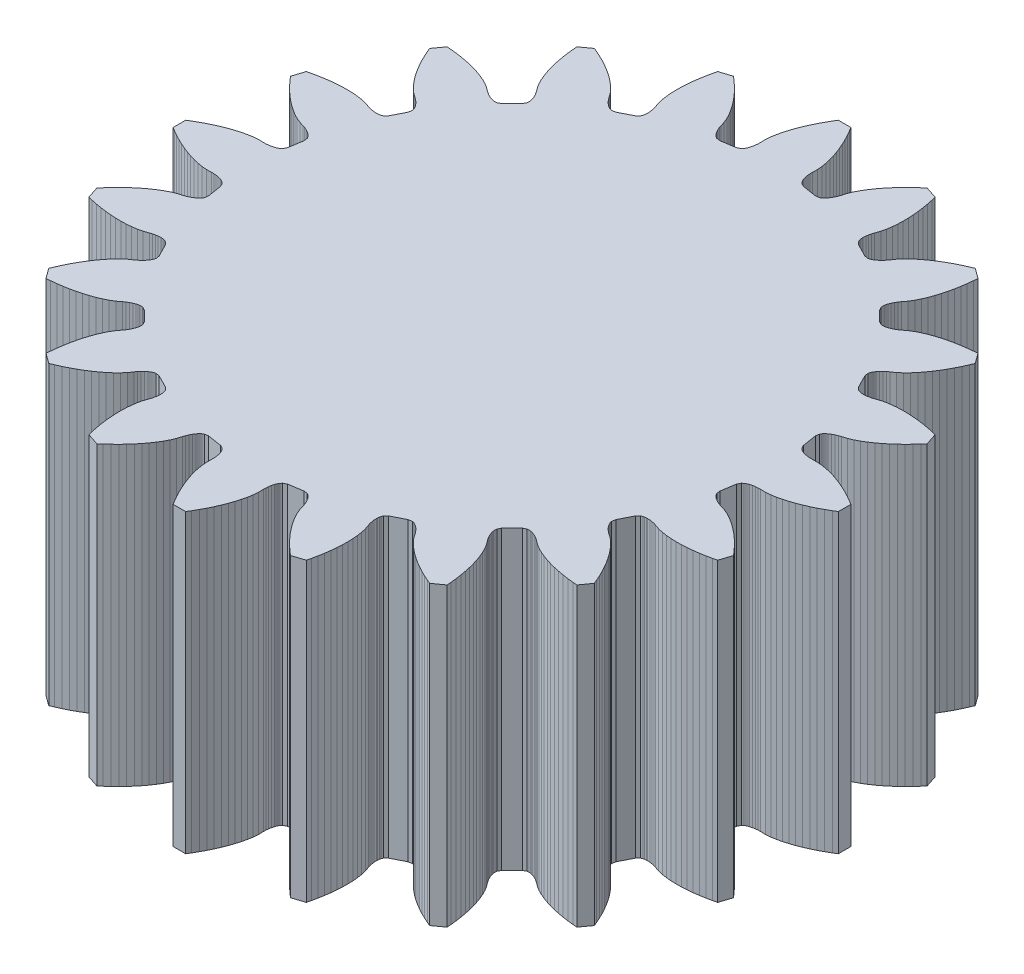
from build123d import *

# Parameters (mm, degrees)
BOSS_EXTRUDE1_DEPTH = 10


with BuildPart() as part:
    # Sketch1 → Boss-Extrude1 (new body)
    with BuildSketch(Plane(origin=(0, 0, 0), x_dir=(1, 0, 0), z_dir=(0, 1, 0))):
        Polygon((19.92687, 12.3554), (19.98148, 12.24614), (20.02708, 12.20669), (20.07113, 12.17955), (20.11437, 12.15911), (20.15707, 12.14317), (20.24143, 12.12063), (20.32482, 12.10703), (20.40752, 12.10005), (20.48971, 12.09838), (20.65336, 12.10249), (20.81867, 12.0882), (20.9851, 12.05997), (21.15222, 12.02082), (21.31978, 11.97211), (21.48756, 11.91469), (21.65538, 11.8491), (21.82305, 11.77576), (21.99042, 11.69495), (22.15733, 11.60692), (22.32361, 11.51187), (22.44783, 11.43607), (22.44783, 11.01375), (22.32361, 10.93794), (22.15733, 10.84289), (21.99042, 10.75486), (21.82305, 10.67406), (21.65538, 10.60071), (21.48756, 10.53512), (21.31978, 10.4777), (21.15222, 10.429), (20.9851, 10.38984), (20.81867, 10.36162), (20.65336, 10.34733), (20.48971, 10.35143), (20.40752, 10.34976), (20.32482, 10.34278), (20.24143, 10.32918), (20.15707, 10.30665), (20.11437, 10.2907), (20.07113, 10.27026), (20.02708, 10.24312), (19.98148, 10.20368), (19.92687, 10.09441), (19.85031, 9.61102), (19.86848, 9.49022), (19.89966, 9.43862), (19.93317, 9.39919), (19.96797, 9.36639), (20.00366, 9.33803), (20.07692, 9.29053), (20.15203, 9.25183), (20.22853, 9.21963), (20.30618, 9.19265), (20.46309, 9.14598), (20.61589, 9.08131), (20.76545, 9.00304), (20.91229, 8.91415), (21.0566, 8.81605), (21.19843, 8.7096), (21.33776, 8.59536), (21.47457, 8.47379), (21.60877, 8.34522), (21.74031, 8.20992), (21.86908, 8.06814), (21.96379, 7.95766), (21.83329, 7.55601), (21.69173, 7.5223), (21.50421, 7.48328), (21.31827, 7.45114), (21.13412, 7.42601), (20.95199, 7.40807), (20.77212, 7.39755), (20.5948, 7.39478), (20.42039, 7.40024), (20.24935, 7.41465), (20.08235, 7.43923), (19.92071, 7.47673), (19.76634, 7.5312), (19.68766, 7.55501), (19.60684, 7.57393), (19.52333, 7.58676), (19.43615, 7.5914), (19.3906, 7.58943), (19.34316, 7.58335), (19.29288, 7.57115), (19.23733, 7.54773), (19.15163, 7.46069), (18.92943, 7.02461), (18.90939, 6.90411), (18.92309, 6.8454), (18.94278, 6.79755), (18.96574, 6.7556), (18.99092, 6.7176), (19.04592, 6.64978), (19.10539, 6.58977), (19.1682, 6.53551), (19.2337, 6.48585), (19.36851, 6.39298), (19.49385, 6.28425), (19.61191, 6.16359), (19.7241, 6.03368), (19.83103, 5.89579), (19.93302, 5.75072), (20.03023, 5.59902), (20.12277, 5.44112), (20.21068, 5.27737), (20.29397, 5.10805), (20.37262, 4.93341), (20.42856, 4.79907), (20.18032, 4.45741), (20.03528, 4.46909), (19.84488, 4.48993), (19.65811, 4.51682), (19.47521, 4.54983), (19.29644, 4.58904), (19.12213, 4.63462), (18.95264, 4.68679), (18.78845, 4.74587), (18.63023, 4.81243), (18.479, 4.88742), (18.33686, 4.97302), (18.20688, 5.07254), (18.1394, 5.11949), (18.06839, 5.16246), (17.99293, 5.20047), (17.91144, 5.23182), (17.86752, 5.24403), (17.82053, 5.25291), (17.76893, 5.25684), (17.70886, 5.25173), (17.60046, 5.19543), (17.25438, 4.84936), (17.19809, 4.74095), (17.19297, 4.68088), (17.19691, 4.62929), (17.20579, 4.58229), (17.21799, 4.53837), (17.24934, 4.45688), (17.28735, 4.38142), (17.33032, 4.31041), (17.37728, 4.24294), (17.47679, 4.11296), (17.5624, 3.97082), (17.63739, 3.81959), (17.70394, 3.66136), (17.76303, 3.49718), (17.81519, 3.32769), (17.86077, 3.15337), (17.89999, 2.97461), (17.93299, 2.7917), (17.95988, 2.60493), (17.98072, 2.41454), (17.99241, 2.26949), (17.65074, 2.02126), (17.51641, 2.07719), (17.34177, 2.15585), (17.17245, 2.23914), (17.0087, 2.32704), (16.8508, 2.41958), (16.6991, 2.5168), (16.55402, 2.61878), (16.41613, 2.72572), (16.28622, 2.83791), (16.16556, 2.95596), (16.05684, 3.0813), (15.96397, 3.21611), (15.91431, 3.28162), (15.86005, 3.34443), (15.80003, 3.40389), (15.73222, 3.45889), (15.69421, 3.48407), (15.65226, 3.50704), (15.60441, 3.52672), (15.5457, 3.54043), (15.42521, 3.52038), (14.98913, 3.29819), (14.90209, 3.21249), (14.87866, 3.15693), (14.86646, 3.10665), (14.86038, 3.05921), (14.85842, 3.01367), (14.86305, 2.92648), (14.87588, 2.84297), (14.8948, 2.76215), (14.91861, 2.68347), (14.97309, 2.5291), (15.01058, 2.36747), (15.03517, 2.20046), (15.04957, 2.02942), (15.05503, 1.85501), (15.05227, 1.6777), (15.04175, 1.49783), (15.0238, 1.31569), (14.99867, 1.13154), (14.96653, 0.9456), (14.92751, 0.75809), (14.89381, 0.61653), (14.49216, 0.48602), (14.38168, 0.58073), (14.23989, 0.70951), (14.1046, 0.84104), (13.97603, 0.97525), (13.85445, 1.11205), (13.74022, 1.25139), (13.63376, 1.39321), (13.53566, 1.53752), (13.44678, 1.68436), (13.36851, 1.83392), (13.30383, 1.98673), (13.25717, 2.14364), (13.23018, 2.22128), (13.19799, 2.29779), (13.15928, 2.37289), (13.11178, 2.44615), (13.08342, 2.48184), (13.05062, 2.51665), (13.01119, 2.55016), (12.95959, 2.58133), (12.8388, 2.5995), (12.3554, 2.52294), (12.24614, 2.46833), (12.20669, 2.42274), (12.17955, 2.37868), (12.15911, 2.33545), (12.14317, 2.29274), (12.12063, 2.20838), (12.10703, 2.125), (12.10005, 2.04229), (12.09838, 1.9601), (12.10249, 1.79645), (12.0882, 1.63114), (12.05997, 1.46472), (12.02082, 1.29759), (11.97211, 1.13003), (11.91469, 0.96225), (11.8491, 0.79443), (11.77576, 0.62676), (11.69495, 0.45939), (11.60692, 0.29248), (11.51187, 0.1262), (11.43607, 0.00199), (11.01375, 0.00199), (10.93794, 0.1262), (10.84289, 0.29248), (10.75486, 0.45939), (10.67406, 0.62676), (10.60071, 0.79443), (10.53512, 0.96225), (10.4777, 1.13003), (10.429, 1.29759), (10.38984, 1.46472), (10.36162, 1.63114), (10.34733, 1.79645), (10.35143, 1.9601), (10.34976, 2.04229), (10.34278, 2.125), (10.32918, 2.20838), (10.30665, 2.29274), (10.2907, 2.33545), (10.27026, 2.37868), (10.24312, 2.42274), (10.20368, 2.46833), (10.09441, 2.52294), (9.61102, 2.5995), (9.49022, 2.58133), (9.43862, 2.55016), (9.39919, 2.51665), (9.36639, 2.48184), (9.33803, 2.44615), (9.29053, 2.37289), (9.25183, 2.29779), (9.21963, 2.22128), (9.19265, 2.14364), (9.14598, 1.98673), (9.08131, 1.83392), (9.00304, 1.68436), (8.91415, 1.53752), (8.81605, 1.39321), (8.7096, 1.25139), (8.59536, 1.11205), (8.47379, 0.97525), (8.34522, 0.84104), (8.20992, 0.70951), (8.06814, 0.58073), (7.95766, 0.48602), (7.55601, 0.61653), (7.5223, 0.75809), (7.48328, 0.9456), (7.45114, 1.13154), (7.42601, 1.31569), (7.40807, 1.49783), (7.39755, 1.6777), (7.39478, 1.85501), (7.40024, 2.02942), (7.41465, 2.20046), (7.43923, 2.36747), (7.47673, 2.5291), (7.5312, 2.68347), (7.55501, 2.76215), (7.57393, 2.84297), (7.58676, 2.92648), (7.5914, 3.01367), (7.58943, 3.05921), (7.58335, 3.10665), (7.57115, 3.15693), (7.54773, 3.21249), (7.46069, 3.29819), (7.02461, 3.52038), (6.90411, 3.54043), (6.8454, 3.52672), (6.79755, 3.50704), (6.7556, 3.48407), (6.7176, 3.45889), (6.64978, 3.40389), (6.58977, 3.34443), (6.53551, 3.28162), (6.48585, 3.21611), (6.39298, 3.0813), (6.28425, 2.95596), (6.16359, 2.83791), (6.03368, 2.72572), (5.89579, 2.61878), (5.75072, 2.5168), (5.59902, 2.41958), (5.44112, 2.32704), (5.27737, 2.23914), (5.10805, 2.15585), (4.93341, 2.07719), (4.79907, 2.02126), (4.45741, 2.26949), (4.46909, 2.41454), (4.48993, 2.60493), (4.51682, 2.7917), (4.54983, 2.97461), (4.58904, 3.15337), (4.63462, 3.32769), (4.68679, 3.49718), (4.74587, 3.66136), (4.81243, 3.81959), (4.88742, 3.97082), (4.97302, 4.11296), (5.07254, 4.24294), (5.11949, 4.31041), (5.16246, 4.38142), (5.20047, 4.45688), (5.23182, 4.53837), (5.24403, 4.58229), (5.25291, 4.62929), (5.25684, 4.68088), (5.25173, 4.74095), (5.19543, 4.84936), (4.84936, 5.19543), (4.74095, 5.25173), (4.68088, 5.25684), (4.62929, 5.25291), (4.58229, 5.24403), (4.53837, 5.23182), (4.45688, 5.20047), (4.38142, 5.16246), (4.31041, 5.11949), (4.24294, 5.07254), (4.11296, 4.97302), (3.97082, 4.88742), (3.81959, 4.81243), (3.66136, 4.74587), (3.49718, 4.68679), (3.32769, 4.63462), (3.15337, 4.58904), (2.97461, 4.54983), (2.7917, 4.51682), (2.60493, 4.48993), (2.41454, 4.46909), (2.26949, 4.45741), (2.02126, 4.79907), (2.07719, 4.93341), (2.15585, 5.10805), (2.23914, 5.27737), (2.32704, 5.44112), (2.41958, 5.59902), (2.5168, 5.75072), (2.61878, 5.89579), (2.72572, 6.03368), (2.83791, 6.16359), (2.95596, 6.28425), (3.0813, 6.39298), (3.21611, 6.48585), (3.28162, 6.53551), (3.34443, 6.58977), (3.40389, 6.64978), (3.45889, 6.7176), (3.48407, 6.7556), (3.50704, 6.79755), (3.52672, 6.8454), (3.54043, 6.90411), (3.52038, 7.02461), (3.29819, 7.46069), (3.21249, 7.54773), (3.15693, 7.57115), (3.10665, 7.58335), (3.05921, 7.58943), (3.01367, 7.5914), (2.92648, 7.58676), (2.84297, 7.57393), (2.76215, 7.55501), (2.68347, 7.5312), (2.5291, 7.47673), (2.36747, 7.43923), (2.20046, 7.41465), (2.02942, 7.40024), (1.85501, 7.39478), (1.6777, 7.39755), (1.49783, 7.40807), (1.31569, 7.42601), (1.13154, 7.45114), (0.9456, 7.48328), (0.75809, 7.5223), (0.61653, 7.55601), (0.48602, 7.95766), (0.58073, 8.06814), (0.70951, 8.20992), (0.84104, 8.34522), (0.97525, 8.47379), (1.11205, 8.59536), (1.25139, 8.7096), (1.39321, 8.81605), (1.53752, 8.91415), (1.68436, 9.00304), (1.83392, 9.08131), (1.98673, 9.14598), (2.14364, 9.19265), (2.22128, 9.21963), (2.29779, 9.25183), (2.37289, 9.29053), (2.44615, 9.33803), (2.48184, 9.36639), (2.51665, 9.39919), (2.55016, 9.43862), (2.58133, 9.49022), (2.5995, 9.61102), (2.52294, 10.09441), (2.46833, 10.20368), (2.42274, 10.24312), (2.37868, 10.27026), (2.33545, 10.2907), (2.29274, 10.30665), (2.20838, 10.32918), (2.125, 10.34278), (2.04229, 10.34976), (1.9601, 10.35143), (1.79645, 10.34733), (1.63114, 10.36162), (1.46472, 10.38984), (1.29759, 10.429), (1.13003, 10.4777), (0.96225, 10.53512), (0.79443, 10.60071), (0.62676, 10.67406), (0.45939, 10.75486), (0.29248, 10.84289), (0.1262, 10.93794), (0.00199, 11.01375), (0.00199, 11.43607), (0.1262, 11.51187), (0.29248, 11.60692), (0.45939, 11.69495), (0.62676, 11.77576), (0.79443, 11.8491), (0.96225, 11.91469), (1.13003, 11.97211), (1.29759, 12.02082), (1.46472, 12.05997), (1.63114, 12.0882), (1.79645, 12.10249), (1.9601, 12.09838), (2.04229, 12.10005), (2.125, 12.10703), (2.20838, 12.12063), (2.29274, 12.14317), (2.33545, 12.15911), (2.37868, 12.17955), (2.42274, 12.20669), (2.46833, 12.24614), (2.52294, 12.3554), (2.5995, 12.8388), (2.58133, 12.95959), (2.55016, 13.01119), (2.51665, 13.05062), (2.48184, 13.08342), (2.44615, 13.11178), (2.37289, 13.15928), (2.29779, 13.19799), (2.22128, 13.23018), (2.14364, 13.25717), (1.98673, 13.30383), (1.83392, 13.36851), (1.68436, 13.44678), (1.53752, 13.53566), (1.39321, 13.63376), (1.25139, 13.74022), (1.11205, 13.85445), (0.97525, 13.97603), (0.84104, 14.1046), (0.70951, 14.23989), (0.58073, 14.38168), (0.48602, 14.49216), (0.61653, 14.89381), (0.75809, 14.92751), (0.9456, 14.96653), (1.13154, 14.99867), (1.31569, 15.0238), (1.49783, 15.04175), (1.6777, 15.05227), (1.85501, 15.05503), (2.02942, 15.04957), (2.20046, 15.03517), (2.36747, 15.01058), (2.5291, 14.97309), (2.68347, 14.91861), (2.76215, 14.8948), (2.84297, 14.87588), (2.92648, 14.86305), (3.01367, 14.85842), (3.05921, 14.86038), (3.10665, 14.86646), (3.15693, 14.87866), (3.21249, 14.90209), (3.29819, 14.98913), (3.52038, 15.42521), (3.54043, 15.5457), (3.52672, 15.60441), (3.50704, 15.65226), (3.48407, 15.69421), (3.45889, 15.73222), (3.40389, 15.80003), (3.34443, 15.86005), (3.28162, 15.91431), (3.21611, 15.96397), (3.0813, 16.05684), (2.95596, 16.16556), (2.83791, 16.28622), (2.72572, 16.41613), (2.61878, 16.55402), (2.5168, 16.6991), (2.41958, 16.8508), (2.32704, 17.0087), (2.23914, 17.17245), (2.15585, 17.34177), (2.07719, 17.51641), (2.02126, 17.65074), (2.26949, 17.99241), (2.41454, 17.98072), (2.60493, 17.95988), (2.7917, 17.93299), (2.97461, 17.89999), (3.15337, 17.86077), (3.32769, 17.81519), (3.49718, 17.76303), (3.66136, 17.70394), (3.81959, 17.63739), (3.97082, 17.5624), (4.11296, 17.47679), (4.24294, 17.37728), (4.31041, 17.33032), (4.38142, 17.28735), (4.45688, 17.24934), (4.53837, 17.21799), (4.58229, 17.20579), (4.62929, 17.19691), (4.68088, 17.19297), (4.74095, 17.19809), (4.84936, 17.25438), (5.19543, 17.60046), (5.25173, 17.70886), (5.25684, 17.76893), (5.25291, 17.82053), (5.24403, 17.86752), (5.23182, 17.91144), (5.20047, 17.99293), (5.16246, 18.06839), (5.11949, 18.1394), (5.07254, 18.20688), (4.97302, 18.33686), (4.88742, 18.479), (4.81243, 18.63023), (4.74587, 18.78845), (4.68679, 18.95264), (4.63462, 19.12213), (4.58904, 19.29644), (4.54983, 19.47521), (4.51682, 19.65811), (4.48993, 19.84488), (4.46909, 20.03528), (4.45741, 20.18032), (4.79907, 20.42856), (4.93341, 20.37262), (5.10805, 20.29397), (5.27737, 20.21068), (5.44112, 20.12277), (5.59902, 20.03023), (5.75072, 19.93302), (5.89579, 19.83103), (6.03368, 19.7241), (6.16359, 19.61191), (6.28425, 19.49385), (6.39298, 19.36851), (6.48585, 19.2337), (6.53551, 19.1682), (6.58977, 19.10539), (6.64978, 19.04592), (6.7176, 18.99092), (6.7556, 18.96574), (6.79755, 18.94278), (6.8454, 18.92309), (6.90411, 18.90939), (7.02461, 18.92943), (7.46069, 19.15163), (7.54773, 19.23733), (7.57115, 19.29288), (7.58335, 19.34316), (7.58943, 19.3906), (7.5914, 19.43615), (7.58676, 19.52333), (7.57393, 19.60684), (7.55501, 19.68766), (7.5312, 19.76634), (7.47673, 19.92071), (7.43923, 20.08235), (7.41465, 20.24935), (7.40024, 20.42039), (7.39478, 20.5948), (7.39755, 20.77212), (7.40807, 20.95199), (7.42601, 21.13412), (7.45114, 21.31827), (7.48328, 21.50421), (7.5223, 21.69173), (7.55601, 21.83329), (7.95766, 21.96379), (8.06814, 21.86908), (8.20992, 21.74031), (8.34522, 21.60877), (8.47379, 21.47457), (8.59536, 21.33776), (8.7096, 21.19843), (8.81605, 21.0566), (8.91415, 20.91229), (9.00304, 20.76545), (9.08131, 20.61589), (9.14598, 20.46309), (9.19265, 20.30618), (9.21963, 20.22853), (9.25183, 20.15203), (9.29053, 20.07692), (9.33803, 20.00366), (9.36639, 19.96797), (9.39919, 19.93317), (9.43862, 19.89966), (9.49022, 19.86848), (9.61102, 19.85031), (10.09441, 19.92687), (10.20368, 19.98148), (10.24312, 20.02708), (10.27026, 20.07113), (10.2907, 20.11437), (10.30665, 20.15707), (10.32918, 20.24143), (10.34278, 20.32482), (10.34976, 20.40752), (10.35143, 20.48971), (10.34733, 20.65336), (10.36162, 20.81867), (10.38984, 20.9851), (10.429, 21.15222), (10.4777, 21.31978), (10.53512, 21.48756), (10.60071, 21.65538), (10.67406, 21.82305), (10.75486, 21.99042), (10.84289, 22.15733), (10.93794, 22.32361), (11.01375, 22.44783), (11.43607, 22.44783), (11.51187, 22.32361), (11.60692, 22.15733), (11.69495, 21.99042), (11.77576, 21.82305), (11.8491, 21.65538), (11.91469, 21.48756), (11.97211, 21.31978), (12.02082, 21.15222), (12.05997, 20.9851), (12.0882, 20.81867), (12.10249, 20.65336), (12.09838, 20.48971), (12.10005, 20.40752), (12.10703, 20.32482), (12.12063, 20.24143), (12.14317, 20.15707), (12.15911, 20.11437), (12.17955, 20.07113), (12.20669, 20.02708), (12.24614, 19.98148), (12.3554, 19.92687), (12.8388, 19.85031), (12.95959, 19.86848), (13.01119, 19.89966), (13.05062, 19.93317), (13.08342, 19.96797), (13.11178, 20.00366), (13.15928, 20.07692), (13.19799, 20.15203), (13.23018, 20.22853), (13.25717, 20.30618), (13.30383, 20.46309), (13.36851, 20.61589), (13.44678, 20.76545), (13.53566, 20.91229), (13.63376, 21.0566), (13.74022, 21.19843), (13.85445, 21.33776), (13.97603, 21.47457), (14.1046, 21.60877), (14.23989, 21.74031), (14.38168, 21.86908), (14.49216, 21.96379), (14.89381, 21.83329), (14.92751, 21.69173), (14.96653, 21.50421), (14.99867, 21.31827), (15.0238, 21.13412), (15.04175, 20.95199), (15.05227, 20.77212), (15.05503, 20.5948), (15.04957, 20.42039), (15.03517, 20.24935), (15.01058, 20.08235), (14.97309, 19.92071), (14.91861, 19.76634), (14.8948, 19.68766), (14.87588, 19.60684), (14.86305, 19.52333), (14.85842, 19.43615), (14.86038, 19.3906), (14.86646, 19.34316), (14.87866, 19.29288), (14.90209, 19.23733), (14.98913, 19.15163), (15.42521, 18.92943), (15.5457, 18.90939), (15.60441, 18.92309), (15.65226, 18.94278), (15.69421, 18.96574), (15.73222, 18.99092), (15.80003, 19.04592), (15.86005, 19.10539), (15.91431, 19.1682), (15.96397, 19.2337), (16.05684, 19.36851), (16.16556, 19.49385), (16.28622, 19.61191), (16.41613, 19.7241), (16.55402, 19.83103), (16.6991, 19.93302), (16.8508, 20.03023), (17.0087, 20.12277), (17.17245, 20.21068), (17.34177, 20.29397), (17.51641, 20.37262), (17.65074, 20.42856), (17.99241, 20.18032), (17.98072, 20.03528), (17.95988, 19.84488), (17.93299, 19.65811), (17.89999, 19.47521), (17.86077, 19.29644), (17.81519, 19.12213), (17.76303, 18.95264), (17.70394, 18.78845), (17.63739, 18.63023), (17.5624, 18.479), (17.47679, 18.33686), (17.37728, 18.20688), (17.33032, 18.1394), (17.28735, 18.06839), (17.24934, 17.99293), (17.21799, 17.91144), (17.20579, 17.86752), (17.19691, 17.82053), (17.19297, 17.76893), (17.19809, 17.70886), (17.25438, 17.60046), (17.60046, 17.25438), (17.70886, 17.19809), (17.76893, 17.19297), (17.82053, 17.19691), (17.86752, 17.20579), (17.91144, 17.21799), (17.99293, 17.24934), (18.06839, 17.28735), (18.1394, 17.33032), (18.20688, 17.37728), (18.33686, 17.47679), (18.479, 17.5624), (18.63023, 17.63739), (18.78845, 17.70394), (18.95264, 17.76303), (19.12213, 17.81519), (19.29644, 17.86077), (19.47521, 17.89999), (19.65811, 17.93299), (19.84488, 17.95988), (20.03528, 17.98072), (20.18032, 17.99241), (20.42856, 17.65074), (20.37262, 17.51641), (20.29397, 17.34177), (20.21068, 17.17245), (20.12277, 17.0087), (20.03023, 16.8508), (19.93302, 16.6991), (19.83103, 16.55402), (19.7241, 16.41613), (19.61191, 16.28622), (19.49385, 16.16556), (19.36851, 16.05684), (19.2337, 15.96397), (19.1682, 15.91431), (19.10539, 15.86005), (19.04592, 15.80003), (18.99092, 15.73222), (18.96574, 15.69421), (18.94278, 15.65226), (18.92309, 15.60441), (18.90939, 15.5457), (18.92943, 15.42521), (19.15163, 14.98913), (19.23733, 14.90209), (19.29288, 14.87866), (19.34316, 14.86646), (19.3906, 14.86038), (19.43615, 14.85842), (19.52333, 14.86305), (19.60684, 14.87588), (19.68766, 14.8948), (19.76634, 14.91861), (19.92071, 14.97309), (20.08235, 15.01058), (20.24935, 15.03517), (20.42039, 15.04957), (20.5948, 15.05503), (20.77212, 15.05227), (20.95199, 15.04175), (21.13412, 15.0238), (21.31827, 14.99867), (21.50421, 14.96653), (21.69173, 14.92751), (21.83329, 14.89381), (21.96379, 14.49216), (21.86908, 14.38168), (21.74031, 14.23989), (21.60877, 14.1046), (21.47457, 13.97603), (21.33776, 13.85445), (21.19843, 13.74022), (21.0566, 13.63376), (20.91229, 13.53566), (20.76545, 13.44678), (20.61589, 13.36851), (20.46309, 13.30383), (20.30618, 13.25717), (20.22853, 13.23018), (20.15203, 13.19799), (20.07692, 13.15928), (20.00366, 13.11178), (19.96797, 13.08342), (19.93317, 13.05062), (19.89966, 13.01119), (19.86848, 12.95959), (19.85031, 12.8388), align=None)
    extrude(amount=BOSS_EXTRUDE1_DEPTH)


solid = part.part
